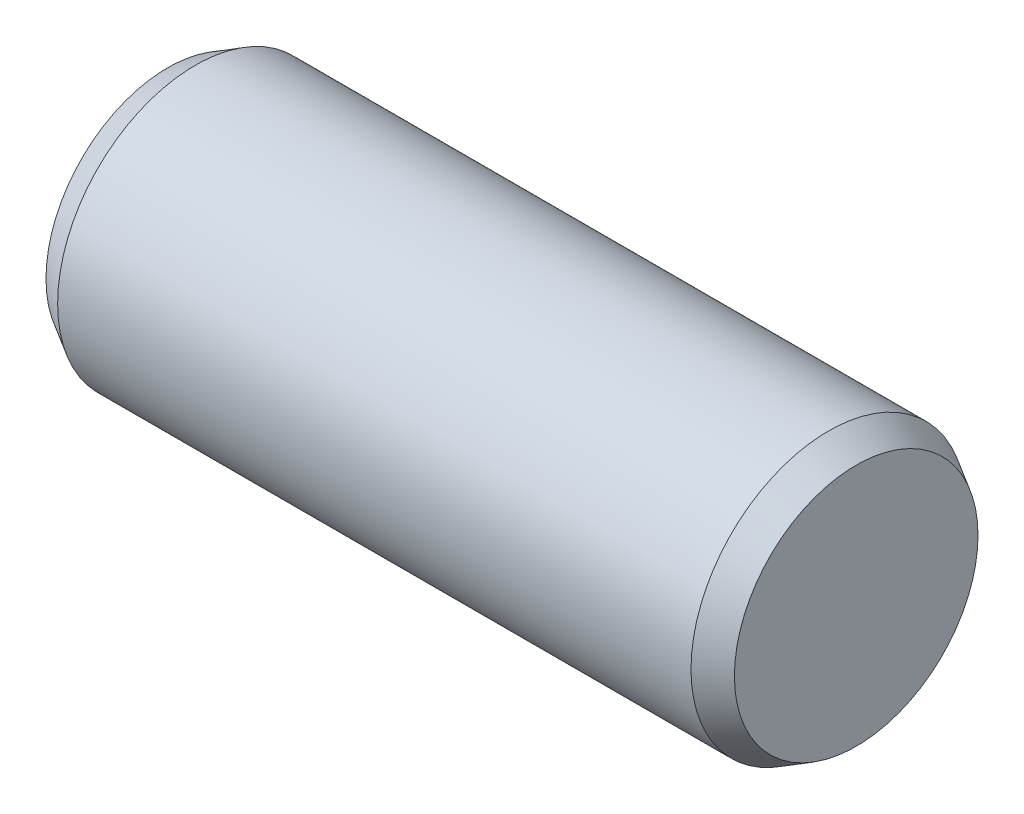
from build123d import *


with BuildPart() as part:
    # BodySke → BaseBody (revolve)
    with BuildSketch(Plane.XY):
        Polygon((0, 0), (0, 17.690598923), (4, 20), (96, 20), (100, 17.690598923), (100, 0), align=None)
    revolve(axis=Axis((0, 0, 0), (1, 0, 0)))


solid = part.part
